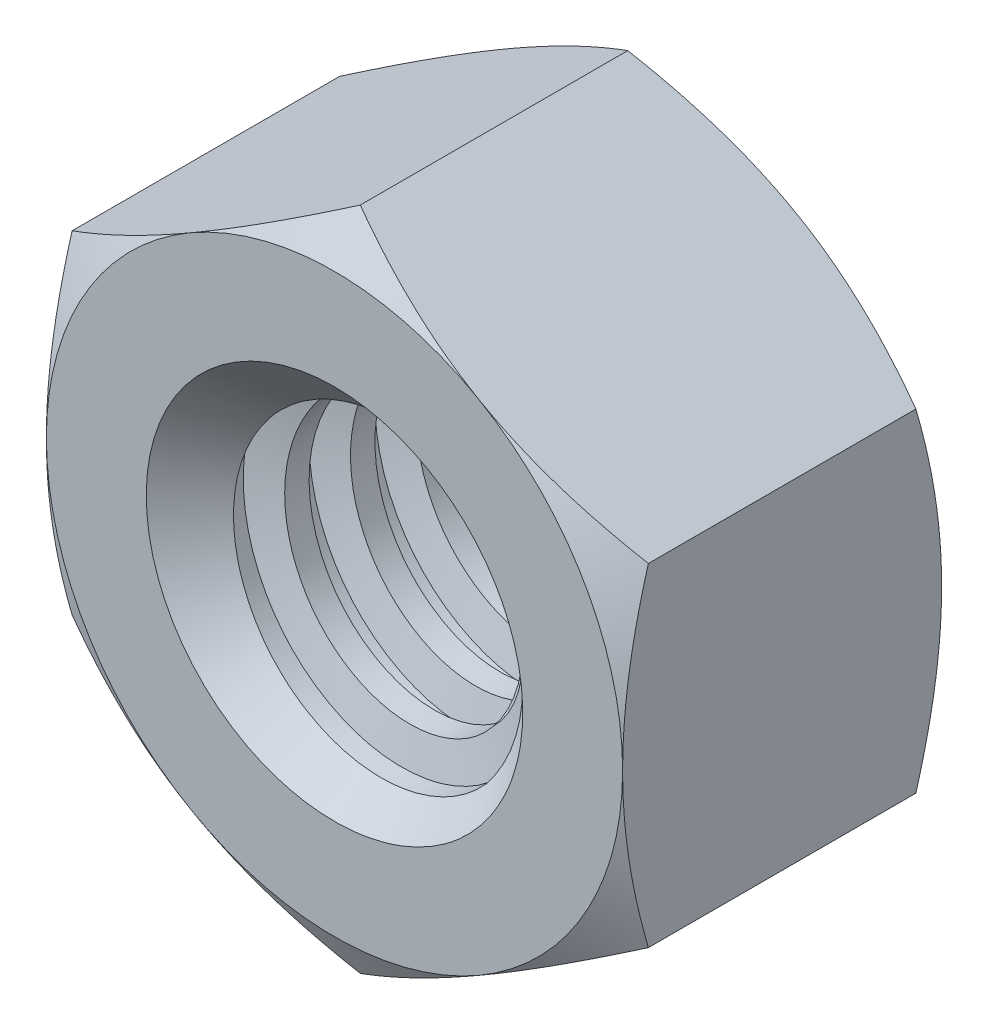
from build123d import *

# Parameters (mm, degrees)
BOSS_EXTRUDE1_START          = 6.151562
SKETCH3_R                    = 6.35
BOSS_EXTRUDE1_DEPTH          = 12.303124
SKETCH4_OUTSIDE_W            = 107.534
SKETCH4_OUTSIDE_H            = 110.972
SKETCH4_OUTSIDE_R            = 11.1125
CUT_EXTRUDE1_DEPTH           = 21.964368272
CUT_EXTRUDE1_DRAFT           = -60
SKETCH5_OUTSIDE_W            = 107.534
SKETCH5_OUTSIDE_H            = 110.972
SKETCH5_OUTSIDE_R            = 11.1125
CUT_EXTRUDE2_DEPTH           = 21.964368272
CUT_EXTRUDE2_DRAFT           = -60
SWEEP1_PITCH                 = 2.54
SKETCH9_R                    = 7.260181408
CUT_EXTRUDE4_OTHER_WAY_DEPTH = 21.964370676


# Read off the part's stored shape, not the designer's step: Cut-Extrude3
with BuildPart() as part:
    # Sketch3 → Boss-Extrude1 (new body)
    with BuildSketch(Plane.XY.offset(BOSS_EXTRUDE1_START)):
        Polygon((11.1125, 6.415804866), (0, 12.831609733), (-11.1125, 6.415804866), (-11.1125, -6.415804866), (0, -12.831609733), (11.1125, -6.415804866), align=None)
        Circle(SKETCH3_R, mode=Mode.SUBTRACT)
    extrude(amount=-BOSS_EXTRUDE1_DEPTH)


with BuildPart() as cut_extrude1_tool:
    # Sketch4 outside → Cut-Extrude1 (with draft: the straight prism first)
    with BuildSketch(Plane.XY.offset(6.1515625)):
        Rectangle(SKETCH4_OUTSIDE_W, SKETCH4_OUTSIDE_H)
        Circle(SKETCH4_OUTSIDE_R, mode=Mode.SUBTRACT)
    extrude(amount=-CUT_EXTRUDE1_DEPTH)
    # Cut-Extrude1: the draft: its side faces are tilted about the plane it starts from
    cut_extrude1_sides = [cut_extrude1_tool.faces().sort_by_distance(p)[0] for p in [
        (0, -55.486, -4.830621636),
        (53.767, 0, -4.830621636),
        (0, 55.486, -4.830621636),
        (-53.767, 0, -4.830621636),
        (-11.1125, 0, -4.830621636),
    ]]
    draft(cut_extrude1_sides, Plane.XY.offset(6.1515625), CUT_EXTRUDE1_DRAFT)


with BuildPart() as part_1:
    add(part.part)

    # Cut-Extrude1: cut by cut_extrude1_tool
    add(cut_extrude1_tool.part, mode=Mode.SUBTRACT)


with BuildPart() as cut_extrude2_tool:
    # Sketch5 outside → Cut-Extrude2 (with draft: the straight prism first)
    with BuildSketch(Plane(origin=(0, 0, -6.1515625), x_dir=(-1, 0, 0), z_dir=(0, 0, -1))):
        Rectangle(SKETCH5_OUTSIDE_W, SKETCH5_OUTSIDE_H)
        Circle(SKETCH5_OUTSIDE_R, mode=Mode.SUBTRACT)
    extrude(amount=-CUT_EXTRUDE2_DEPTH)
    # Cut-Extrude2: the draft: its side faces are tilted about the plane it starts from
    cut_extrude2_sides = [cut_extrude2_tool.faces().sort_by_distance(p)[0] for p in [
        (0, -55.486, 4.830621636),
        (-53.767, 0, 4.830621636),
        (0, 55.486, 4.830621636),
        (53.767, 0, 4.830621636),
        (11.1125, 0, 4.830621636),
    ]]
    draft(cut_extrude2_sides, Plane(origin=(0, 0, -6.1515625), x_dir=(-1, 0, 0), z_dir=(0, 0, -1)), CUT_EXTRUDE2_DRAFT)


with BuildPart() as part_2:
    add(part_1.part)

    # Cut-Extrude2: cut by cut_extrude2_tool
    add(cut_extrude2_tool.part, mode=Mode.SUBTRACT)

    # Sweep1: the profile of Sketch7 screwed along a right-hand helix of 5.84375 turns, 10 arcs to a turn; built about Z, then put on its axis
    sweep1_z = Axis((0, 0, 0), (0, 0, 1))
    sweep1_corners = [(7.260181408, 0, -1.833833249), (5.08, 0, -1.27), (5.08, 0, -0.328444332), (7.260181408, 0, 0.235388917)]
    with BuildLine(mode=Mode.PRIVATE) as sweep1_profile:
        Line(sweep1_corners[0], sweep1_corners[1])
        Line(sweep1_corners[1], sweep1_corners[2])
        Line(sweep1_corners[2], sweep1_corners[3])
        Line(sweep1_corners[3], sweep1_corners[0])
    sweep1_cap = Face(sweep1_profile.wire())
    sweep1_turn_angles = [0, 18, 36, 54, 72, 90, 108, 126, 144, 162, 180, 198, 216, 234, 252, 270, 288, 306, 324, 342, 360]
    sweep1_turn_weights = [1, 0.9510565162951535, 1, 0.9510565162951535, 1, 0.9510565162951535, 1, 0.9510565162951535, 1, 0.9510565162951535, 1, 0.9510565162951535, 1, 0.9510565162951535, 1, 0.9510565162951535, 1, 0.9510565162951535, 1, 0.9510565162951535, 1]
    sweep1_turn_rails = [Edge.make_bspline([Vector(p[0], p[1], 0).rotate(sweep1_z, sweep1_turn_angles[k]) / sweep1_turn_weights[k] + Vector(0, 0, p[2] + SWEEP1_PITCH * sweep1_turn_angles[k] / 360) for k in range(21)], [0, 0, 0, 1, 1, 2, 2, 3, 3, 4, 4, 5, 5, 6, 6, 7, 7, 8, 8, 9, 9, 10, 10, 10], 2, sweep1_turn_weights) for p in sweep1_corners]
    sweep1_turn_sides = [Face.make_surface_from_curves(sweep1_turn_rails[p[0]], sweep1_turn_rails[p[1]]) for p in [(0, 1), (1, 2), (2, 3), (3, 0)]]
    sweep1_last_angles = [1800, 1818, 1836, 1854, 1872, 1890, 1908, 1926, 1944, 1962, 1980, 1998, 2016, 2034, 2052, 2070, 2088, 2095.875, 2103.75]
    sweep1_last_weights = [1, 0.9510565162951535, 1, 0.9510565162951535, 1, 0.9510565162951535, 1, 0.9510565162951535, 1, 0.9510565162951535, 1, 0.9510565162951535, 1, 0.9510565162951535, 1, 0.9510565162951535, 1, 0.9905693404435686, 1]
    sweep1_last_rails = [Edge.make_bspline([Vector(p[0], p[1], 0).rotate(sweep1_z, sweep1_last_angles[k]) / sweep1_last_weights[k] + Vector(0, 0, p[2] + SWEEP1_PITCH * sweep1_last_angles[k] / 360) for k in range(19)], [0, 0, 0, 1, 1, 2, 2, 3, 3, 4, 4, 5, 5, 6, 6, 7, 7, 8, 8, 9, 9, 9], 2, sweep1_last_weights) for p in sweep1_corners]
    sweep1_last_sides = [Face.make_surface_from_curves(sweep1_last_rails[p[0]], sweep1_last_rails[p[1]]) for p in [(0, 1), (1, 2), (2, 3), (3, 0)]]
    sweep1 = Plane(origin=(0, 0, 6.1515625), x_dir=(0, 1, 0), z_dir=(0, 0, -1)) * Solid(Shell([*[p.moved(Location((0, 0, SWEEP1_PITCH * i))) for i in range(5) for p in sweep1_turn_sides], *sweep1_last_sides, sweep1_cap, sweep1_cap.rotate(sweep1_z, 2103.75).moved(Location((0, 0, SWEEP1_PITCH * 2103.75 / 360)))]))
    add(sweep1)

    # Cut-Extrude3 outline → Cut-Extrude3 (revolve, cut)
    with BuildSketch(Plane.XZ):
        Polygon((5.079990294, 3.971371386), (7.260184813, 6.151565906), (7.260184813, 7.985395849), (5.079990294, 7.985395849), align=None)
    revolve(axis=Axis((0, 0, 0), (0, 0, 1)), mode=Mode.SUBTRACT)

    # Cut-Extrude4 cone 1 section (through the dimple's axis) → Cut-Extrude4 (revolve, cut)
    with BuildSketch(Plane(origin=(0, 0, -6.1515625), x_dir=(0, 1, 0), z_dir=(1, 0, 0))):
        Polygon((0, 0), (7.260181408, 0), (0, 7.260181408), align=None)
    revolve(axis=Axis((0, 0, -6.1515625), (0, 0, 1)), mode=Mode.SUBTRACT)

    # Sketch9 → Cut-Extrude4 other way (cut)
    with BuildSketch(Plane(origin=(0, 0, -6.1515625), x_dir=(-1, 0, 0), z_dir=(0, 0, -1))):
        Circle(SKETCH9_R)
    extrude(amount=CUT_EXTRUDE4_OTHER_WAY_DEPTH, mode=Mode.SUBTRACT)


solid = part_2.part
